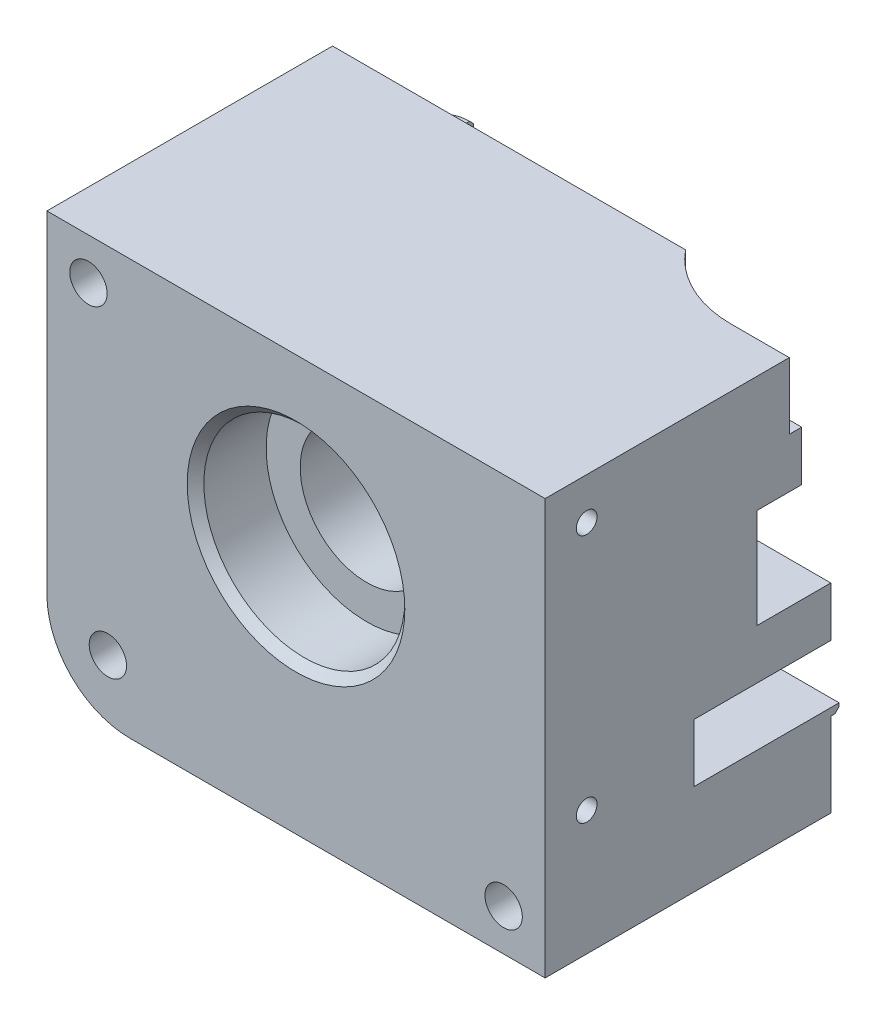
from build123d import *

# Parameters (mm, degrees)
SCHIZZO1_W                   = 60
SCHIZZO1_H                   = 60
SCHIZZO1_R                   = 8
ESTRUSIONE_ESTRUSIONE1_DEPTH = 4
SCHIZZO2_W                   = 60
SCHIZZO2_H                   = 60
SCHIZZO2_R                   = 12.1
ESTRUSIONE_ESTRUSIONE2_DEPTH = 8.5
SCHIZZO6_W                   = 60
SCHIZZO6_H                   = 60
SCHIZZO6_R                   = 12.1
ESTRUSIONE_ESTRUSIONE3_DEPTH = 9.4
SCHIZZO3_W                   = 60
SCHIZZO3_H                   = 10
TAGLIO_ESTRUSIONE1_DEPTH     = 55.620142805
RACCORDO2_R                  = 10
SCHIZZO10_R                  = 2.25
TAGLIO_ESTRUSIONE3_DEPTH     = 55.62014286
ESTRUSIONE_ESTRUSIONE5_DEPTH = 1
SMUSSO2_SIZE                 = 0.5
SCHIZZO12_R                  = 1.25
TAGLIO_ESTRUSIONE4_DEPTH     = 10
SCHIZZO14_W                  = 1.470153799
SCHIZZO14_H                  = 12
SCHIZZO14_W_2                = 1
SCHIZZO14_H_2                = 7
TAGLIO_ESTRUSIONE5_DEPTH     = 7
SMUSSO3_SIZE                 = 1


# Read off the part's stored shape, not the designer's step: Estrusione-Estrusione5
with BuildPart() as part:
    # Schizzo1 → Estrusione-Estrusione1 (new, symmetric)
    with BuildSketch(Plane.XY):
        Rectangle(SCHIZZO1_W, SCHIZZO1_H)
        Circle(SCHIZZO1_R, mode=Mode.SUBTRACT)
    extrude(amount=ESTRUSIONE_ESTRUSIONE1_DEPTH, both=True)

    # Schizzo2 → Estrusione-Estrusione2 (add)
    with BuildSketch(Plane.XY.offset(4)):
        Rectangle(SCHIZZO2_W, SCHIZZO2_H)
        Circle(SCHIZZO2_R, mode=Mode.SUBTRACT)
    estrusione_estrusione2 = extrude(amount=ESTRUSIONE_ESTRUSIONE2_DEPTH)

    # Specchia1: Estrusione-Estrusione2 across plane
    add(estrusione_estrusione2.mirror(Plane.XY))

    # Schizzo6 → Estrusione-Estrusione3 (add)
    with BuildSketch(Plane(origin=(0, 0, -12.5), x_dir=(-1, 0, 0), z_dir=(0, 0, -1))):
        Rectangle(SCHIZZO6_W, SCHIZZO6_H)
        with Locations(Location((0, 0, 0), (0, 0, 180))):
            Circle(SCHIZZO6_R, mode=Mode.SUBTRACT)
    extrude(amount=ESTRUSIONE_ESTRUSIONE3_DEPTH)

    # Schizzo3 → Taglio-Estrusione1 (cut, through all)
    with BuildSketch(Plane.XY.offset(12.5)):
        with Locations((0, 25)):
            Rectangle(SCHIZZO3_W, SCHIZZO3_H)
    extrude(amount=-TAGLIO_ESTRUSIONE1_DEPTH, mode=Mode.SUBTRACT)

    # Raccordo2
    raccordo2_edges = [part.edges().sort_by_distance(p)[0] for p in [
        (-30, -30, -4.7),
    ]]
    fillet(raccordo2_edges, radius=RACCORDO2_R)

    # Schizzo13 → Taglia-Rivoluzione4 (revolve, cut)
    with BuildSketch(Plane(origin=(0, 0, -30.4), x_dir=(-1, 0, 0), z_dir=(0, 0, -1))):
        Polygon((-9.5, 25.081325019), (-22, 25.081325019), (-22, -19), (2, -19), (2, -12), (-16, -12), (-16, -6), (-5.6, -6), (-5.6, 6), (-11, 6), (-11, 12), (-9.5, 12), align=None)
    revolve(axis=Axis((23, 27.323096352, -30.4), (0, -1, 0)), mode=Mode.SUBTRACT)

    # Schizzo10 → Taglio-Estrusione3 (cut, through all)
    with BuildSketch(Plane(origin=(0, 0, -21.9), x_dir=(-1, 0, 0), z_dir=(0, 0, -1))):
        with Locations((-25, -25)):
            Circle(SCHIZZO10_R)
        with Locations((22.656854249, -22.656854249)):
            Circle(SCHIZZO10_R)
        with Locations((25, 15)):
            Circle(SCHIZZO10_R)
    extrude(amount=-TAGLIO_ESTRUSIONE3_DEPTH, mode=Mode.SUBTRACT)

    # Estrusione-Estrusione5 outline → Estrusione-Estrusione5 (add)
    with BuildSketch(Plane(origin=(0, 0, -21.9), x_dir=(-1, 0, 0), z_dir=(0, 0, -1))):
        with BuildLine():
            Line((14, 19.9), (14, 18.9))
            ThreePointArc((14, 18.9), (17.464823228, 17.464823228), (18.9, 14))
            Line((18.9, 14), (18.9, -14))
            ThreePointArc((18.9, -14), (17.464823228, -17.464823228), (14, -18.9))
            Line((14, -18.9), (0.510635891, -18.9))
            Line((0.510635891, -18.9), (0.510635891, -19))
            Line((0.510635891, -19), (-30, -19))
            Line((-30, -19), (-30, -19.9))
            Line((-30, -19.9), (14, -19.9))
            ThreePointArc((14, -19.9), (18.171930009, -18.171930009), (19.9, -14))
            Line((19.9, -14), (19.9, 14))
            ThreePointArc((19.9, 14), (18.171930009, 18.171930009), (14, 19.9))
        make_face()
    extrude(amount=ESTRUSIONE_ESTRUSIONE5_DEPTH)

    # Smusso2
    smusso2_edges = [part.edges().sort_by_distance(p)[0] for p in [
        (8, -19.9, -22.9),
        (-18.171930009, -18.171930009, -22.9),
        (-19.9, 0, -22.9),
        (-18.171930009, 18.171930009, -22.9),
    ]]
    chamfer(smusso2_edges, length=SMUSSO2_SIZE)

    # Schizzo12 → Taglio-Estrusione4 (cut)
    with BuildSketch(Plane(origin=(30, 0, 0), x_dir=(0, 0, -1), z_dir=(1, 0, 0))):
        with Locations(Location((-7.5, -15, 0), (0, 0, 90))):
            Circle(SCHIZZO12_R)
        with Locations(Location((-7.5, 15, 0), (0, 0, 90))):
            Circle(SCHIZZO12_R)
    extrude(amount=-TAGLIO_ESTRUSIONE4_DEPTH, mode=Mode.SUBTRACT)

    # Schizzo14 → Taglio-Estrusione5 (cut)
    with BuildSketch(Plane(origin=(30, 0, 0), x_dir=(0, 0, -1), z_dir=(1, 0, 0))):
        with Locations((13.7350769, 0)):
            Rectangle(SCHIZZO14_W, SCHIZZO14_H)
        Polygon((20.653205655, 6), (20.653205655, 12), (18.856603619, 12), (18.856603619, 20), (16.9, 20), (16.9, 12), (18.4, 12), (18.4, 6), align=None)
        with Locations((5.9, -15.5)):
            Rectangle(SCHIZZO14_W_2, SCHIZZO14_H_2)
    extrude(amount=-TAGLIO_ESTRUSIONE5_DEPTH, mode=Mode.SUBTRACT)

    # Smusso3
    smusso3_edges = [part.edges().sort_by_distance(p)[0] for p in [
        (-12.1, 0, 12.5),
    ]]
    chamfer(smusso3_edges, length=SMUSSO3_SIZE)


solid = part.part
